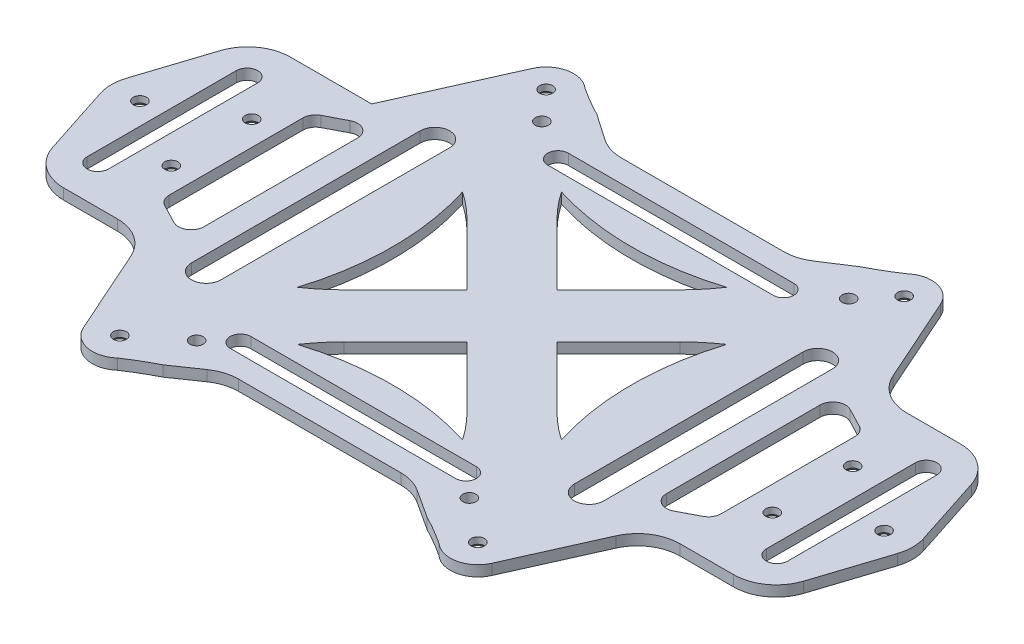
from build123d import *

# Parameters (mm, degrees)
SKETCH_1_R             = 1.55
EXTRUDE_1_DEPTH        = 2.5
CHAMFER_2_SIZE         = 1
CUT_EXTRUDE_4571_DEPTH = 111.115546384
FILLET_2_R             = 3
FILLET_3_R             = 10


with BuildPart() as part:
    # 草图1 → 凸台-拉伸1 (new body)
    with BuildSketch(Plane(origin=(0, 0, 0), x_dir=(1, 0, 0), z_dir=(0, 1, 0))):
        with BuildLine():
            Line((47.899982554, 52.633397656), (59.52497064, 26.588251477))
            Line((59.52497064, 26.588251477), (85.869588061, 26.588251477))
            Line((85.869588061, 26.588251477), (94.505759306, 0))
            Line((94.505759306, 0), (85.869588061, -26.588251477))
            Line((85.869588061, -26.588251477), (59.52497064, -26.588251477))
            Line((59.52497064, -26.588251477), (47.899982554, -52.633397656))
            ThreePointArc((47.899982554, -52.633397656), (43.362068791, -56.315801292), (37.709796983, -54.831018053))
            ThreePointArc((37.709796983, -54.831018053), (34.400449937, -52.764318952), (30.978168019, -50.89055015))
            Line((30.978168019, -50.89055015), (21.786424895, -44.919129219))
            Line((21.786424895, -44.919129219), (0, -44.919129219))
            Line((0, -44.919129219), (-22.317913981, -44.919129219))
            Line((-22.317913981, -44.919129219), (-30.978168019, -50.89055015))
            ThreePointArc((-30.978168019, -50.89055015), (-34.400449937, -52.764318952), (-37.709796983, -54.831018053))
            ThreePointArc((-37.709796983, -54.831018053), (-43.362068791, -56.315801292), (-47.899982554, -52.633397656))
            Line((-47.899982554, -52.633397656), (-59.52497064, -26.588251477))
            Line((-59.52497064, -26.588251477), (-85.869588061, -26.588251477))
            Line((-85.869588061, -26.588251477), (-94.505759306, 0))
            Line((-94.505759306, 0), (-85.869588061, 26.588251477))
            Line((-85.869588061, 26.588251477), (-59.52497064, 26.588251477))
            Line((-59.52497064, 26.588251477), (-47.899982554, 52.633397656))
            ThreePointArc((-47.899982554, 52.633397656), (-43.362068791, 56.315801292), (-37.709796983, 54.831018053))
            ThreePointArc((-37.709796983, 54.831018053), (-34.400449937, 52.764318952), (-30.978168019, 50.89055015))
            Line((-30.978168019, 50.89055015), (-22.317913981, 44.919129219))
            Line((-22.317913981, 44.919129219), (0, 44.919129219))
            Line((0, 44.919129219), (21.786424895, 44.919129219))
            Line((21.786424895, 44.919129219), (30.978168019, 50.89055015))
            ThreePointArc((30.978168019, 50.89055015), (34.400449937, 52.764318952), (37.709796983, 54.831018053))
            ThreePointArc((37.709796983, 54.831018053), (43.362068791, 56.315801292), (47.899982554, 52.633397656))
        make_face()
        with Locations((42, 50)):
            Circle(SKETCH_1_R, mode=Mode.SUBTRACT)
        with Locations((42, -50)):
            Circle(SKETCH_1_R, mode=Mode.SUBTRACT)
        with Locations((-42, -50)):
            Circle(SKETCH_1_R, mode=Mode.SUBTRACT)
        with Locations((-42, 50)):
            Circle(SKETCH_1_R, mode=Mode.SUBTRACT)
        with Locations((36, 43)):
            Circle(SKETCH_1_R, mode=Mode.SUBTRACT)
        with Locations((32, -42)):
            Circle(SKETCH_1_R, mode=Mode.SUBTRACT)
        with Locations((-32, -42)):
            Circle(SKETCH_1_R, mode=Mode.SUBTRACT)
        with Locations((-36, 43)):
            Circle(SKETCH_1_R, mode=Mode.SUBTRACT)
        with Locations((70.5, 9.435839055)):
            Circle(SKETCH_1_R, mode=Mode.SUBTRACT)
        with Locations((70.5, -9.435839055)):
            Circle(SKETCH_1_R, mode=Mode.SUBTRACT)
        with Locations((-70.5, -9.435839055)):
            Circle(SKETCH_1_R, mode=Mode.SUBTRACT)
        with Locations((-70.5, 9.435839055)):
            Circle(SKETCH_1_R, mode=Mode.SUBTRACT)
        with Locations((87.3, 0)):
            Circle(SKETCH_1_R, mode=Mode.SUBTRACT)
        with Locations((-87.3, 0)):
            Circle(SKETCH_1_R, mode=Mode.SUBTRACT)
        with BuildLine():
            Line((77.169642998, -17.5), (77.169642998, 17.5))
            ThreePointArc((77.169642998, 17.5), (79.669642998, 20), (82.169642998, 17.5))
            Line((82.169642998, 17.5), (82.169642998, -17.5))
            ThreePointArc((82.169642998, -17.5), (79.669642998, -20), (77.169642998, -17.5))
        make_face(mode=Mode.SUBTRACT)
        with BuildLine():
            Line((-77.169642998, -17.5), (-77.169642998, 17.5))
            ThreePointArc((-77.169642998, 17.5), (-79.669642998, 20), (-82.169642998, 17.5))
            Line((-82.169642998, 17.5), (-82.169642998, -17.5))
            ThreePointArc((-82.169642998, -17.5), (-79.669642998, -20), (-77.169642998, -17.5))
        make_face(mode=Mode.SUBTRACT)
        with BuildLine():
            Line((-24.995975583, 14.429581723), (-10.56639386, 0))
            Line((-10.56639386, 0), (-24.995975583, -14.429581723))
            ThreePointArc((-24.995975583, -14.429581723), (-27.869597938, -17.042325553), (-30.978168019, -19.370614155))
            ThreePointArc((-30.978168019, -19.370614155), (-28.024295248, 0), (-30.978168019, 19.370614155))
            ThreePointArc((-30.978168019, 19.370614155), (-27.869597938, 17.042325553), (-24.995975583, 14.429581723))
        make_face(mode=Mode.SUBTRACT)
        with BuildLine():
            Line((14.429581723, 24.995975583), (0, 10.56639386))
            Line((0, 10.56639386), (-14.429581723, 24.995975583))
            ThreePointArc((-14.429581723, 24.995975583), (-17.042325553, 27.869597938), (-19.370614155, 30.978168019))
            ThreePointArc((-19.370614155, 30.978168019), (0, 28.024295248), (19.370614155, 30.978168019))
            ThreePointArc((19.370614155, 30.978168019), (17.042325553, 27.869597938), (14.429581723, 24.995975583))
        make_face(mode=Mode.SUBTRACT)
        with BuildLine():
            Line((24.995975583, -14.429581723), (10.56639386, 0))
            Line((10.56639386, 0), (24.995975583, 14.429581723))
            ThreePointArc((24.995975583, 14.429581723), (27.869597938, 17.042325553), (30.978168019, 19.370614155))
            ThreePointArc((30.978168019, 19.370614155), (28.024295248, 0), (30.978168019, -19.370614155))
            ThreePointArc((30.978168019, -19.370614155), (27.869597938, -17.042325553), (24.995975583, -14.429581723))
        make_face(mode=Mode.SUBTRACT)
        with BuildLine():
            Line((-14.429581723, -24.995975583), (0, -10.56639386))
            Line((0, -10.56639386), (14.429581723, -24.995975583))
            ThreePointArc((14.429581723, -24.995975583), (17.042325553, -27.869597938), (19.370614155, -30.978168019))
            ThreePointArc((19.370614155, -30.978168019), (0, -28.024295248), (-19.370614155, -30.978168019))
            ThreePointArc((-19.370614155, -30.978168019), (-17.042325553, -27.869597938), (-14.429581723, -24.995975583))
        make_face(mode=Mode.SUBTRACT)
        with BuildLine():
            Line((41.468701347, -26.829343455), (41.468701347, 26.829343455))
            ThreePointArc((41.468701347, 26.829343455), (44.919200659, 30.279842767), (48.36969997, 26.829343455))
            Line((48.36969997, 26.829343455), (48.36969997, -26.829343455))
            ThreePointArc((48.36969997, -26.829343455), (44.919200659, -30.279842767), (41.468701347, -26.829343455))
        make_face(mode=Mode.SUBTRACT)
        with BuildLine():
            Line((-26.453510137, -34.819129219), (26.453510137, -34.819129219))
            ThreePointArc((26.453510137, -34.819129219), (28.878510137, -37.244129219), (26.453510137, -39.669129219))
            Line((26.453510137, -39.669129219), (-26.453510137, -39.669129219))
            ThreePointArc((-26.453510137, -39.669129219), (-28.878510137, -37.244129219), (-26.453510137, -34.819129219))
        make_face(mode=Mode.SUBTRACT)
        with BuildLine():
            Line((-26.453510137, 34.819129219), (26.453510137, 34.819129219))
            ThreePointArc((26.453510137, 34.819129219), (28.878510137, 37.244129219), (26.453510137, 39.669129219))
            Line((26.453510137, 39.669129219), (-26.453510137, 39.669129219))
            ThreePointArc((-26.453510137, 39.669129219), (-28.878510137, 37.244129219), (-26.453510137, 34.819129219))
        make_face(mode=Mode.SUBTRACT)
        with BuildLine():
            Line((-41.468701347, -26.829343455), (-41.468701347, 26.829343455))
            ThreePointArc((-41.468701347, 26.829343455), (-44.919200659, 30.279842767), (-48.36969997, 26.829343455))
            Line((-48.36969997, 26.829343455), (-48.36969997, -26.829343455))
            ThreePointArc((-48.36969997, -26.829343455), (-44.919200659, -30.279842767), (-41.468701347, -26.829343455))
        make_face(mode=Mode.SUBTRACT)
    extrude(amount=EXTRUDE_1_DEPTH)

    # 倒角2
    chamfer_2_edges = [part.edges().sort_by_distance(p)[0] for p in [
        (-72.05, 0, 9.435839055),
        (-72.05, 0, -9.435839055),
        (68.95, 0, 9.435839055),
        (68.95, 0, -9.435839055),
        (-88.85, 0, 0),
        (85.75, 0, 0),
        (-43.55, 0, 50),
        (40.45, 0, 50),
        (-43.55, 0, -50),
        (40.45, 0, -50),
    ]]
    chamfer(chamfer_2_edges, length=CHAMFER_2_SIZE)

    # Sketch 4326 → Cut-Extrude 4571 (cut, through all)
    with BuildSketch(Plane.XZ):
        Polygon((-64.75, 17.5), (-54.25, 22.965954031), (-54.25, -22.965954031), (-64.75, -17.5), align=None)
        Polygon((54.25, -22.965954031), (64.75, -17.5), (64.75, 17.5), (54.25, 22.965954031), align=None)
    extrude(amount=-CUT_EXTRUDE_4571_DEPTH, mode=Mode.SUBTRACT)

    # 圆角2
    fillet_2_edges = [part.edges().sort_by_distance(p)[0] for p in [
        (64.75, 1.25, 17.5),
        (64.75, 1.25, -17.5),
        (54.25, 1.25, -22.965954031),
        (54.25, 1.25, 22.965954031),
        (-54.25, 1.25, -22.965954031),
        (-64.75, 1.25, -17.5),
        (-64.75, 1.25, 17.5),
        (-54.25, 1.25, 22.965954031),
    ]]
    fillet(fillet_2_edges, radius=FILLET_2_R)

    # 圆角3
    fillet_3_edges = [part.edges().sort_by_distance(p)[0] for p in [
        (21.786424895, 1.25, 44.919129219),
        (-22.317913981, 1.25, 44.919129219),
        (21.786424895, 1.25, -44.919129219),
        (-22.317913981, 1.25, -44.919129219),
        (59.52497064, 1.25, -26.588251477),
        (85.869588061, 1.25, -26.588251477),
        (94.505759306, 1.25, 0),
        (85.869588061, 1.25, 26.588251477),
        (59.52497064, 1.25, 26.588251477),
        (-59.52497064, 1.25, 26.588251477),
        (-85.869588061, 1.25, -26.588251477),
        (-94.505759306, 1.25, 0),
        (-85.869588061, 1.25, 26.588251477),
    ]]
    fillet(fillet_3_edges, radius=FILLET_3_R)


solid = part.part
